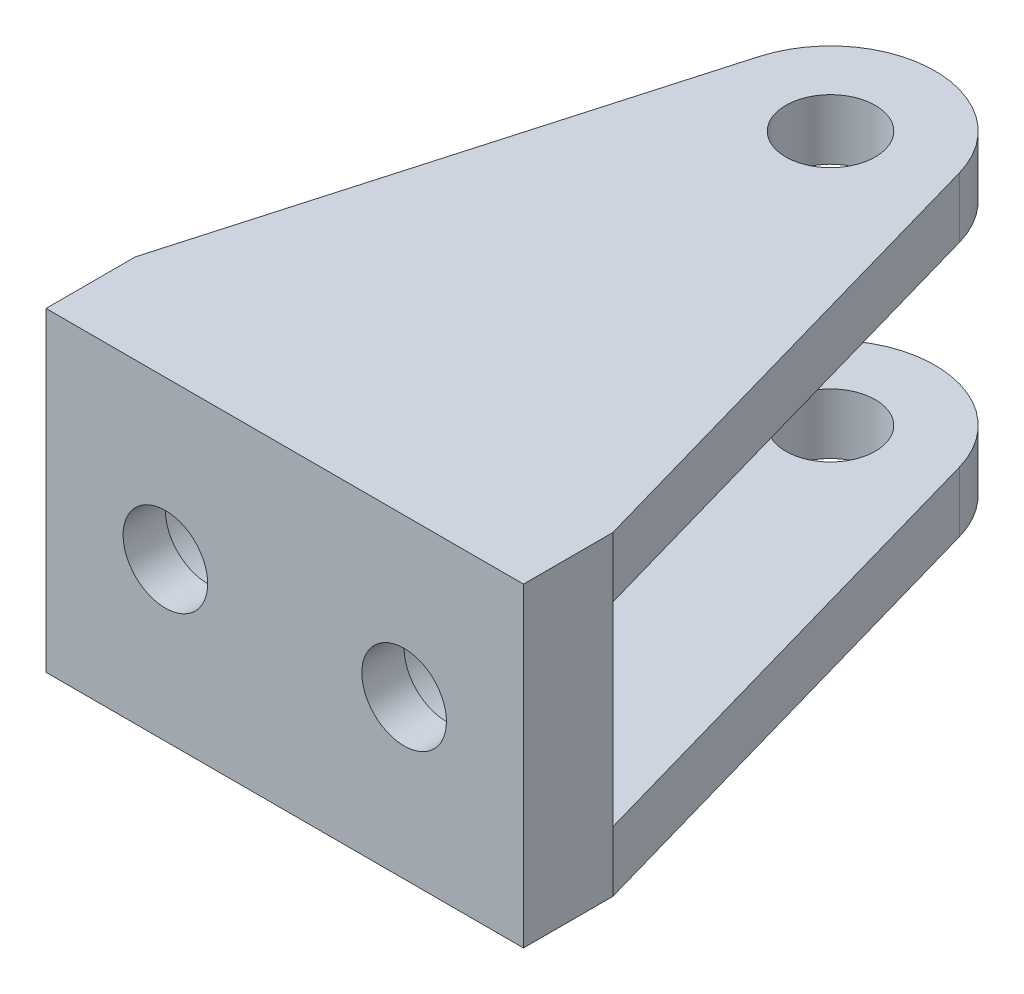
from build123d import *

# Parameters (mm, degrees)
SKETCH1_R                               = 4.7625
BOSS_EXTRUDE1_DEPTH                     = 33.528
CUT_EXTRUDE1_DEPTH                      = 93.142337053
CBORE_FOR_M8_HEX_HEAD_BOLT1_D           = 9
CBORE_FOR_M8_HEX_HEAD_BOLT1_CBORE_D     = 16
CBORE_FOR_M8_HEX_HEAD_BOLT1_CBORE_DEPTH = 5


with BuildPart() as part:
    # Sketch1 → Boss-Extrude1 (new body)
    with BuildSketch(Plane(origin=(0, 0, 0), x_dir=(1, 0, 0), z_dir=(0, 1, 0))):
        with BuildLine():
            Line((0, 0), (50.8, 0))
            Line((50.8, 0), (50.8, 9.4996))
            Line((50.8, 9.4996), (36.086728651, 61.110953296))
            ThreePointArc((36.086728651, 61.110953296), (25.4, 69.1769), (14.713271349, 61.110953296))
            Line((14.713271349, 61.110953296), (0, 9.4996))
            Line((0, 9.4996), (0, 0))
        make_face()
        with Locations((25.4, 58.0644)):
            Circle(SKETCH1_R, mode=Mode.SUBTRACT)
    extrude(amount=BOSS_EXTRUDE1_DEPTH)

    # Sketch2 → Cut-Extrude1 (cut, through all)
    with BuildSketch(Plane(origin=(50.8, 0, 0), x_dir=(0, 0, -1), z_dir=(1, 0, 0))):
        Polygon((9.4996, 16.764), (9.4996, 27.1145), (69.1769, 27.1145), (69.1769, 6.4135), (9.4996, 6.4135), align=None)
    extrude(amount=-CUT_EXTRUDE1_DEPTH, mode=Mode.SUBTRACT)

    # CBORE for M8 Hex Head Bolt1 (through all)
    with Locations(Plane(origin=(0, 0, -9.4996), x_dir=(-1, 0, 0), z_dir=(0, 0, -1))):
        with Locations((-12.7, 16.764), (-38.1, 16.764)):
            CounterBoreHole(CBORE_FOR_M8_HEX_HEAD_BOLT1_D / 2, CBORE_FOR_M8_HEX_HEAD_BOLT1_CBORE_D / 2, CBORE_FOR_M8_HEX_HEAD_BOLT1_CBORE_DEPTH)


solid = part.part
